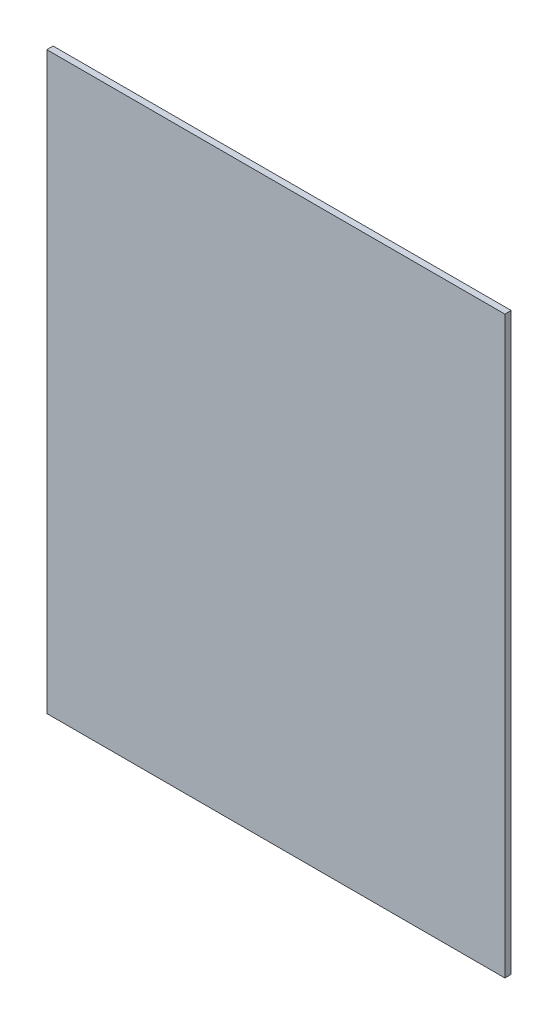
from build123d import *

# Parameters (mm, degrees)
SZKIC1_W                    = 145
SZKIC1_H                    = 182
DODANIE_WYCI_GNI_CIE1_DEPTH = 2


with BuildPart() as part:
    # Szkic1 → Dodanie-wyciągnięcie1 (new body)
    with BuildSketch(Plane.XY):
        Rectangle(SZKIC1_W, SZKIC1_H)
    extrude(amount=DODANIE_WYCI_GNI_CIE1_DEPTH)


solid = part.part
